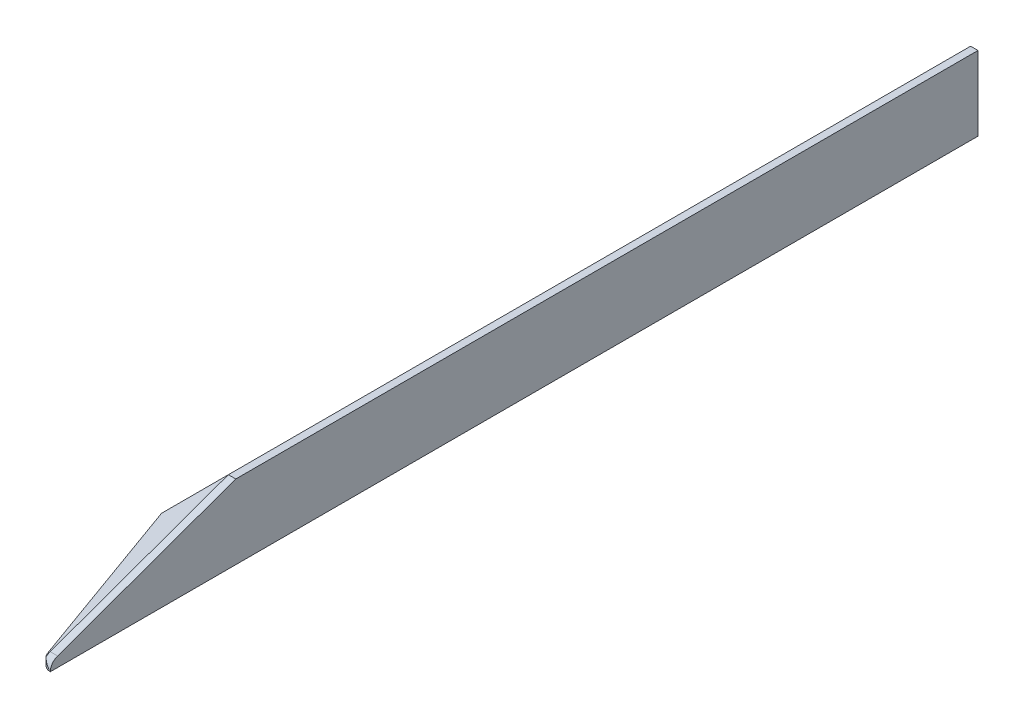
from build123d import *

# Parameters (mm, degrees)
EXTRUDE_1_DEPTH     = 250
CUT_EXTRUDE_1_DEPTH = 10
CUT_EXTRUDE_2_DEPTH = 10
FILLET_1_R          = 3
SKETCH_5_R          = 2.05
CUT_EXTRUDE_4_DEPTH = 10


with BuildPart() as part:
    # 草图1 → 凸台-拉伸1 (new body)
    with BuildSketch(Plane.XY):
        Polygon((-20, 0), (0, 0), (0, 20), (-2, 20), (-2, 2), (-20, 2), align=None)
    extrude(amount=EXTRUDE_1_DEPTH)

    # 草图2 → 切除-拉伸1 (cut)
    with BuildSketch(Plane.ZY.offset(2)):
        Polygon((250, 2), (200, 20), (250, 20), align=None)
    extrude(amount=-CUT_EXTRUDE_1_DEPTH, mode=Mode.SUBTRACT)

    # 草图3 → 切除-拉伸2 (cut)
    with BuildSketch(Plane(origin=(0, 2, 0), x_dir=(1, 0, 0), z_dir=(0, 1, 0))):
        Polygon((-2, -250), (-20, -200), (-20, -250), align=None)
    extrude(amount=-CUT_EXTRUDE_2_DEPTH, mode=Mode.SUBTRACT)

    # 圆角1
    # the kernel refuses this fillet: 3 mm, written as the material it takes off along each edge
    with BuildSketch(Plane(origin=(-7.265916136, 2, 250), x_dir=(0, -1, 0), z_dir=(1, 0, 0))) as fillet_1_piece_1:
        with BuildLine():
            CenterArc((2.10919491, 2.998012087), FILLET_1_R, 199.798876355, 68.115193721)
            Line((-0.713467325, 1.981853682), (-0.76992057, 1.961530514))
            Line((-0.76992057, 1.961530514), (-0.056453245, -0.020323168))
            Line((-0.056453245, -0.020323168), (0, -0.06))
            ThreePointArc((0, -0.06), (1, -0.06), (1.997816102, -0.059960242))
            Line((1.997816102, -0.059960242), (2, 0))
        make_face()
    extrude(amount=12.531832272, mode=Mode.SUBTRACT)
    with BuildSketch(Plane(origin=(-2, 7.265916136, 250), x_dir=(1, 0, 0), z_dir=(0, -1, 0))) as fillet_1_piece_2:
        with BuildLine():
            CenterArc((2.10919491, -2.998012087), FILLET_1_R, 92.085929924, 68.115193721)
            Line((-0.713467325, -1.981853682), (-0.76992057, -1.961530514))
            Line((-0.76992057, -1.961530514), (-0.056453245, 0.020323168))
            Line((-0.056453245, 0.020323168), (0, 0.06))
            ThreePointArc((0, 0.06), (1, 0.06), (1.997816102, 0.059960242))
            Line((1.997816102, 0.059960242), (2, 0))
        make_face()
    extrude(amount=12.531832272, mode=Mode.SUBTRACT)

    # 草图5 → 切除-拉伸4 (cut)
    with BuildSketch(Plane.XZ):
        with Locations(Location((-14, 7.5, 0), (0, 0, 270))):
            Circle(SKETCH_5_R)
        with Locations(Location((-6, 7.5, 0), (0, 0, 270))):
            Circle(SKETCH_5_R)
    extrude(amount=-CUT_EXTRUDE_4_DEPTH, mode=Mode.SUBTRACT)


solid = part.part
